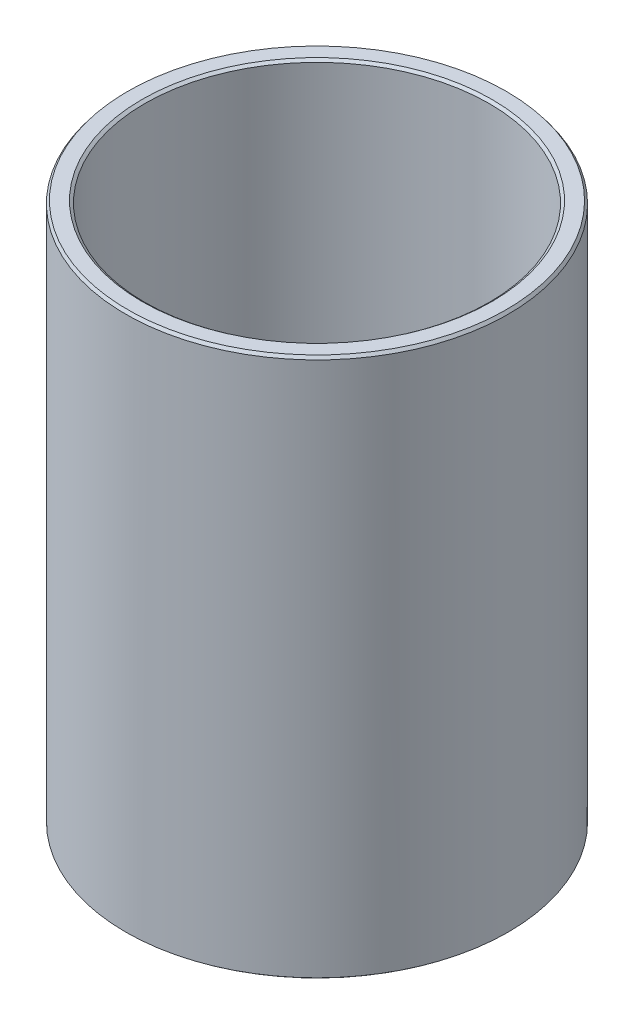
from build123d import *
from OCP.BRepFilletAPI import BRepFilletAPI_MakeChamfer

# Parameters (mm, degrees)
SKETCH1_R           = 55
BOSS_EXTRUDE1_DEPTH = 155.240992245
SKETCH2_R           = 49.502872194
CUT_EXTRUDE1_DEPTH  = 174.636878782
CHAMFER1_SIZE       = 0.807123835
CHAMFER1_SIZE2      = 0.613129846


with BuildPart() as part:
    # Sketch1 → Boss-Extrude1 (new body)
    with BuildSketch(Plane(origin=(0, 0, 0), x_dir=(1, 0, 0), z_dir=(0, 1, 0))):
        Circle(SKETCH1_R)
    extrude(amount=BOSS_EXTRUDE1_DEPTH)

    # Sketch2 → Cut-Extrude1 (cut, through all)
    with BuildSketch(Plane(origin=(0, 0, 0), x_dir=(1, 0, 0), z_dir=(0, 1, 0))):
        Circle(SKETCH2_R)
    extrude(amount=CUT_EXTRUDE1_DEPTH, mode=Mode.SUBTRACT)

    # Chamfer1: one chamfer whose edges measure the first distance from different faces: ONE call of the kernel's chamfer builder (chamfer() names one face for all edges)
    chamfer1_edges_1 = [part.edges().sort_by_distance(p)[0] for p in [
        (-49.502872194, 155.240992245, 0),
    ]]
    chamfer1_side_1 = [part.faces().sort_by_distance(p)[0] for p in [
        (-53.444365081, 155.240992245, 0),
    ]]
    chamfer1_edges_2 = [part.edges().sort_by_distance(p)[0] for p in [
        (-49.502872194, 0, 0),
    ]]
    chamfer1_side_2 = [part.faces().sort_by_distance(p)[0] for p in [
        (-49.502872194, 77.620496122, 0),
    ]]
    chamfer1_edges_3 = [part.edges().sort_by_distance(p)[0] for p in [
        (-55, 0, 0),
    ]]
    chamfer1_side_3 = [part.faces().sort_by_distance(p)[0] for p in [
        (-53.444365081, 0, 0),
    ]]
    chamfer1_edges_4 = [part.edges().sort_by_distance(p)[0] for p in [
        (-55, 155.240992245, 0),
    ]]
    chamfer1_side_4 = [part.faces().sort_by_distance(p)[0] for p in [
        (-55, 77.620496122, 0),
    ]]
    chamfer1 = BRepFilletAPI_MakeChamfer(part.part.solid().wrapped)
    for e in chamfer1_edges_1:
        chamfer1.Add(CHAMFER1_SIZE, CHAMFER1_SIZE2, e.wrapped, chamfer1_side_1[0].wrapped)  # the first distance lies on this face
    for e in chamfer1_edges_2:
        chamfer1.Add(CHAMFER1_SIZE, CHAMFER1_SIZE2, e.wrapped, chamfer1_side_2[0].wrapped)  # the first distance lies on this face
    for e in chamfer1_edges_3:
        chamfer1.Add(CHAMFER1_SIZE, CHAMFER1_SIZE2, e.wrapped, chamfer1_side_3[0].wrapped)  # the first distance lies on this face
    for e in chamfer1_edges_4:
        chamfer1.Add(CHAMFER1_SIZE, CHAMFER1_SIZE2, e.wrapped, chamfer1_side_4[0].wrapped)  # the first distance lies on this face
    add(Compound.cast(chamfer1.Shape()), mode=Mode.REPLACE)


solid = part.part
